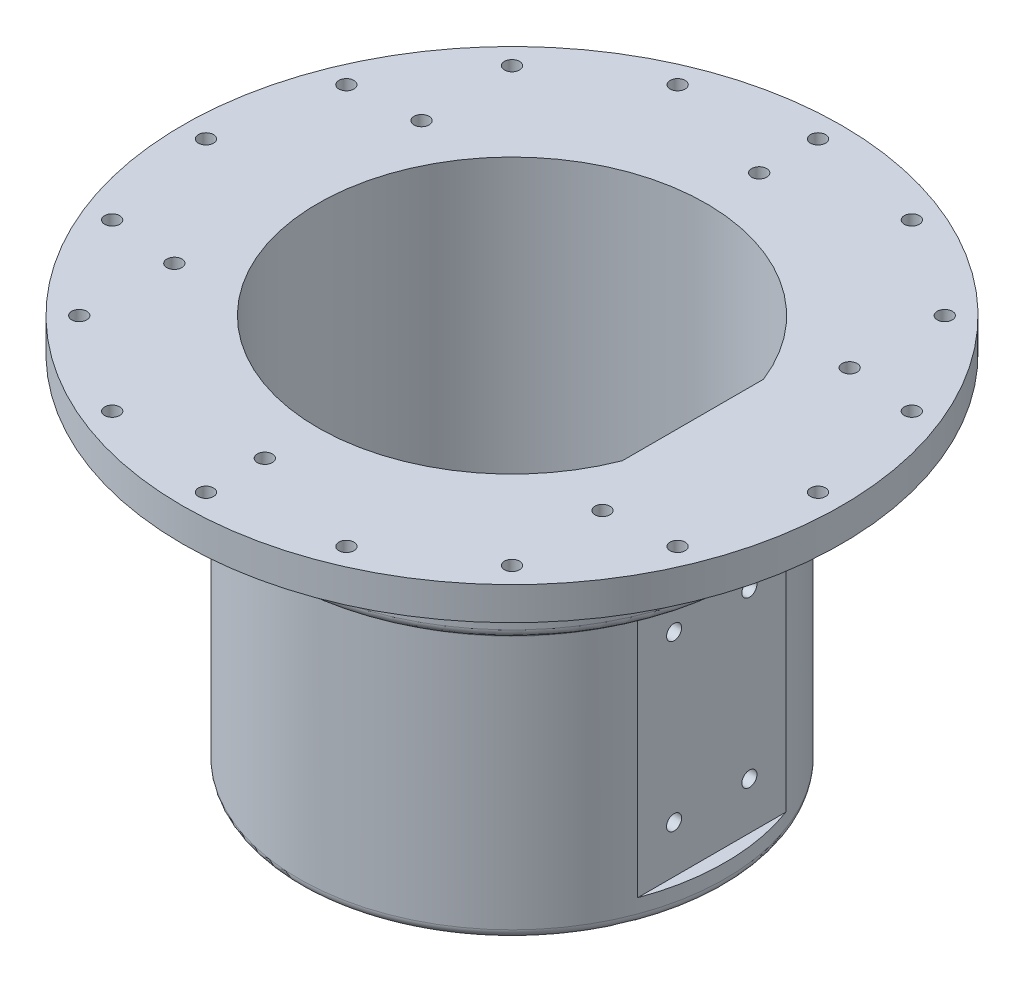
from build123d import *

# Parameters (mm, degrees)
SKETCH1_R           = 60
SKETCH1_R_2         = 49.25
SKETCH1_R_3         = 1.6
BOSS_EXTRUDE1_DEPTH = 7
BOSS_EXTRUDE2_START = -25
SKETCH2_R           = 49.25
SKETCH2_R_2         = 45.25
BOSS_EXTRUDE2_DEPTH = 25
BOSS_EXTRUDE5_START = -78
SKETCH6_R           = 45.25
BOSS_EXTRUDE5_DEPTH = 78
SKETCH7_W           = 17.573934628
SKETCH7_H           = 31.47007957
CUT_EXTRUDE3_DEPTH  = 53
BOSS_EXTRUDE6_START = 5
SKETCH8_R           = 45.25
SKETCH8_R_2         = 32
SKETCH8_R_3         = 1.6
BOSS_EXTRUDE6_DEPTH = 5
SKETCH9_R           = 1.6
CUT_EXTRUDE4_DEPTH  = 4
FILLET1_R           = 2
SKETCH10_W          = 2
SKETCH10_H          = 3.5
BOSS_EXTRUDE7_START = -7
SKETCH11_R          = 70
SKETCH11_R_2        = 60
SKETCH11_R_3        = 1.6
BOSS_EXTRUDE7_DEPTH = 7


with BuildPart() as part:
    # Sketch1 → Boss-Extrude1 (new body)
    with BuildSketch(Plane(origin=(0, 0, 0), x_dir=(1, 0, 0), z_dir=(0, 1, 0))):
        with Locations(Location((0, 0, 0), (0, 0, 270))):
            Circle(SKETCH1_R)
        with Locations(Location((0, 0, 0), (0, 0, 270))):
            Circle(SKETCH1_R_2, mode=Mode.SUBTRACT)
        with Locations(Location((0, 52.5, 0), (0, 0, 270))):
            Circle(SKETCH1_R_3, mode=Mode.SUBTRACT)
        with Locations(Location((45.466333699, 26.25, 0), (0, 0, 270))):
            Circle(SKETCH1_R_3, mode=Mode.SUBTRACT)
        with Locations(Location((45.466333699, -26.25, 0), (0, 0, 270))):
            Circle(SKETCH1_R_3, mode=Mode.SUBTRACT)
        with Locations(Location((0, -52.5, 0), (0, 0, 270))):
            Circle(SKETCH1_R_3, mode=Mode.SUBTRACT)
        with Locations(Location((-45.466333699, -26.25, 0), (0, 0, 270))):
            Circle(SKETCH1_R_3, mode=Mode.SUBTRACT)
        with Locations(Location((-45.466333699, 26.25, 0), (0, 0, 270))):
            Circle(SKETCH1_R_3, mode=Mode.SUBTRACT)
    extrude(amount=BOSS_EXTRUDE1_DEPTH)

    # Sketch2 → Boss-Extrude2 (add)
    with BuildSketch(Plane(origin=(0, 7, 0), x_dir=(1, 0, 0), z_dir=(0, 1, 0)).offset(BOSS_EXTRUDE2_START)):
        with Locations(Location((0, 0, 0), (0, 0, 270))):
            Circle(SKETCH2_R)
        with Locations(Location((0, 0, 0), (0, 0, 270))):
            Circle(SKETCH2_R_2, mode=Mode.SUBTRACT)
    extrude(amount=BOSS_EXTRUDE2_DEPTH)

    # Sketch6 → Boss-Extrude5 (add)
    with BuildSketch(Plane(origin=(0, 7, 0), x_dir=(1, 0, 0), z_dir=(0, 1, 0)).offset(BOSS_EXTRUDE5_START)):
        with Locations(Location((0, 0, 0), (0, 0, 270))):
            Circle(SKETCH6_R)
        with BuildLine():
            ThreePointArc((38.426065372, -15), (-41.25, 0), (38.426065372, 15))
            Line((38.426065372, 15), (38.426065372, -15))
        make_face(mode=Mode.SUBTRACT)
    extrude(amount=BOSS_EXTRUDE5_DEPTH)

    # Sketch7 → Cut-Extrude3 (cut)
    with BuildSketch(Plane.XZ.offset(71)):
        with Locations((51.213032686, 0)):
            Rectangle(SKETCH7_W, SKETCH7_H)
    extrude(amount=-CUT_EXTRUDE3_DEPTH, mode=Mode.SUBTRACT)

    # Sketch8 → Boss-Extrude6 (add)
    with BuildSketch(Plane.XZ.offset(71).offset(BOSS_EXTRUDE6_START)):
        with Locations(Location((0, 0, 0), (0, 0, 20.348881936))):
            Circle(SKETCH8_R)
        with Locations(Location((0, 0, 0), (0, 0, 270))):
            Circle(SKETCH8_R_2, mode=Mode.SUBTRACT)
        with Locations(Location((26.69328099, 26.69328099, 0), (0, 0, 270))):
            Circle(SKETCH8_R_3, mode=Mode.SUBTRACT)
        with Locations(Location((37.75, 0, 0), (0, 0, 65.0048933))):
            Circle(SKETCH8_R_3, mode=Mode.SUBTRACT)
        with Locations(Location((26.69328099, -26.69328099, 0), (0, 0, 270))):
            Circle(SKETCH8_R_3, mode=Mode.SUBTRACT)
        with Locations(Location((0, -37.75, 0), (0, 0, 270))):
            Circle(SKETCH8_R_3, mode=Mode.SUBTRACT)
        with Locations(Location((-26.69328099, -26.69328099, 0), (0, 0, 270))):
            Circle(SKETCH8_R_3, mode=Mode.SUBTRACT)
        with Locations(Location((-37.75, 0, 0), (0, 0, 270))):
            Circle(SKETCH8_R_3, mode=Mode.SUBTRACT)
        with Locations(Location((-26.69328099, 26.69328099, 0), (0, 0, 270))):
            Circle(SKETCH8_R_3, mode=Mode.SUBTRACT)
        with Locations(Location((0, 37.75, 0), (0, 0, 270))):
            Circle(SKETCH8_R_3, mode=Mode.SUBTRACT)
    extrude(amount=-BOSS_EXTRUDE6_DEPTH)

    # Sketch9 → Cut-Extrude4 (cut)
    with BuildSketch(Plane(origin=(42.426065372, 0, 0), x_dir=(0, 0, -1), z_dir=(1, 0, 0))):
        with Locations((-8, -26)):
            Circle(SKETCH9_R)
        with Locations((8, -26)):
            Circle(SKETCH9_R)
        with Locations((8, -61)):
            Circle(SKETCH9_R)
        with Locations((-8, -61)):
            Circle(SKETCH9_R)
    extrude(amount=-CUT_EXTRUDE4_DEPTH, mode=Mode.SUBTRACT)

    # Fillet1
    fillet1_edges = [part.edges().sort_by_distance(p)[0] for p in [
        (0, -18, -49.25),
        (-45.25, -18, 0),
        (42.426065372, -18, 0),
        (-42.426065372, -76, -15.735039784),
    ]]
    fillet(fillet1_edges, radius=FILLET1_R - 0.0001)  # a hair under: the kernel refuses the full size

    # Sketch10 → Cut-Revolve1 (revolve, cut)
    with BuildSketch(Plane(origin=(0, 0, 0), x_dir=(0, 0, -1), z_dir=(1, 0, 0))):
        with Locations((-48.25, -8)):
            Rectangle(SKETCH10_W, SKETCH10_H)
    revolve(axis=Axis((0, 0, 0), (0, -1, 0)), mode=Mode.SUBTRACT)

    # Sketch11 → Boss-Extrude7 (add)
    with BuildSketch(Plane(origin=(0, 7, 0), x_dir=(1, 0, 0), z_dir=(0, 1, 0)).offset(BOSS_EXTRUDE7_START)):
        with Locations(Location((0, 0, 0), (0, 0, 270))):
            Circle(SKETCH11_R)
        Circle(SKETCH11_R_2, mode=Mode.SUBTRACT)
        with Locations(Location((0, 65, 0), (0, 0, 270))):
            Circle(SKETCH11_R_3, mode=Mode.SUBTRACT)
        with Locations(Location((24.874423104, 60.052169613, 0), (0, 0, 270))):
            Circle(SKETCH11_R_3, mode=Mode.SUBTRACT)
        with Locations(Location((45.961940777, 45.961940777, 0), (0, 0, 270))):
            Circle(SKETCH11_R_3, mode=Mode.SUBTRACT)
        with Locations(Location((60.052169613, 24.874423104, 0), (0, 0, 270))):
            Circle(SKETCH11_R_3, mode=Mode.SUBTRACT)
        with Locations(Location((65, 0, 0), (0, 0, 270))):
            Circle(SKETCH11_R_3, mode=Mode.SUBTRACT)
        with Locations(Location((60.052169613, -24.874423104, 0), (0, 0, 270))):
            Circle(SKETCH11_R_3, mode=Mode.SUBTRACT)
        with Locations(Location((45.961940777, -45.961940777, 0), (0, 0, 270))):
            Circle(SKETCH11_R_3, mode=Mode.SUBTRACT)
        with Locations(Location((24.874423104, -60.052169613, 0), (0, 0, 270))):
            Circle(SKETCH11_R_3, mode=Mode.SUBTRACT)
        with Locations(Location((0, -65, 0), (0, 0, 270))):
            Circle(SKETCH11_R_3, mode=Mode.SUBTRACT)
        with Locations(Location((-24.874423104, -60.052169613, 0), (0, 0, 270))):
            Circle(SKETCH11_R_3, mode=Mode.SUBTRACT)
        with Locations(Location((-45.961940777, -45.961940777, 0), (0, 0, 270))):
            Circle(SKETCH11_R_3, mode=Mode.SUBTRACT)
        with Locations(Location((-60.052169613, -24.874423104, 0), (0, 0, 270))):
            Circle(SKETCH11_R_3, mode=Mode.SUBTRACT)
        with Locations(Location((-65, 0, 0), (0, 0, 270))):
            Circle(SKETCH11_R_3, mode=Mode.SUBTRACT)
        with Locations(Location((-60.052169613, 24.874423104, 0), (0, 0, 270))):
            Circle(SKETCH11_R_3, mode=Mode.SUBTRACT)
        with Locations(Location((-45.961940777, 45.961940777, 0), (0, 0, 270))):
            Circle(SKETCH11_R_3, mode=Mode.SUBTRACT)
        with Locations(Location((-24.874423104, 60.052169613, 0), (0, 0, 270))):
            Circle(SKETCH11_R_3, mode=Mode.SUBTRACT)
    extrude(amount=BOSS_EXTRUDE7_DEPTH)


solid = part.part
